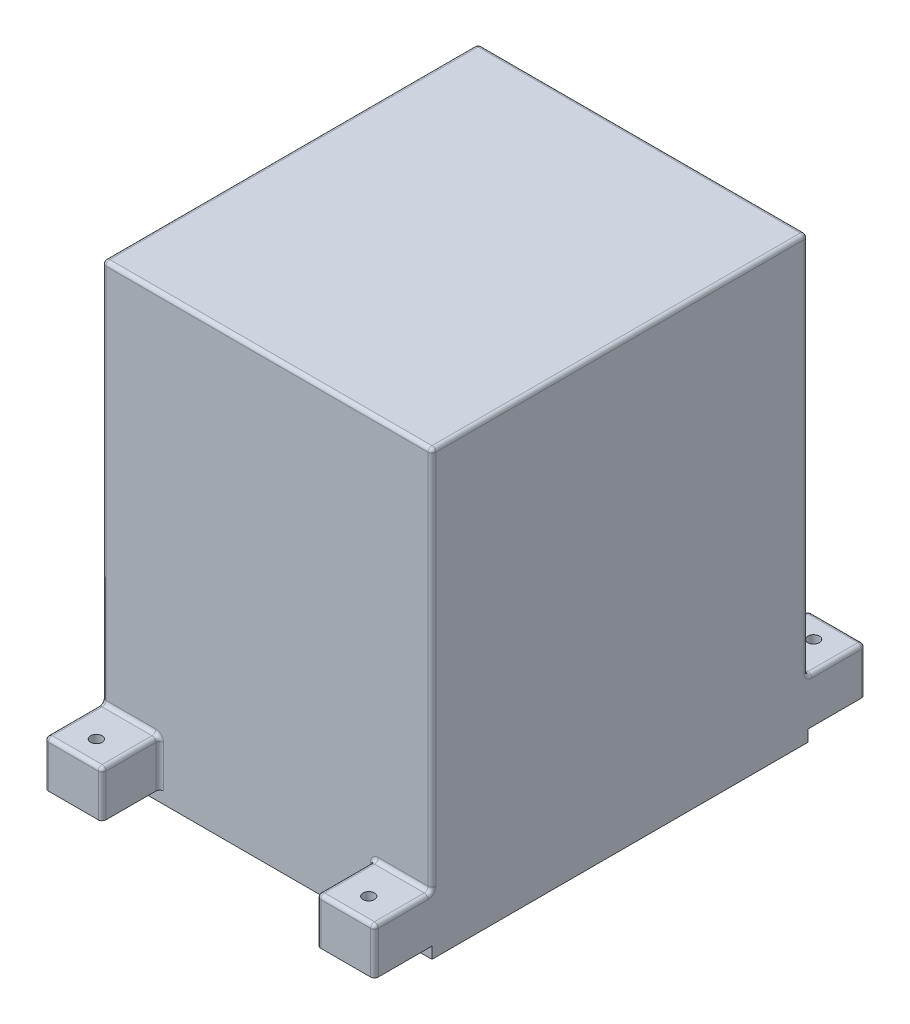
from build123d import *

# Parameters (mm, degrees)
ESBO_O1_W                = 86
ESBO_O1_H                = 98
ESBO_O1_W_2              = 80
ESBO_O1_H_2              = 92
RESSALTO_EXTRUS_O1_DEPTH = 110
ESBO_O2_W                = 86
ESBO_O2_H                = 98
RESSALTO_EXTRUS_O2_DEPTH = 5
ESBO_O3_W                = 7
ESBO_O3_H                = 10
RESSALTO_EXTRUS_O3_DEPTH = 40
ESBO_O4_R                = 3.499646081
CORTE_EXTRUS_O1_DEPTH    = 40
FILETE1_R                = 1
FILETE2_R                = 2
FILETE3_R                = 2
ESBO_O5_W                = 15
ESBO_O5_H                = 15
RESSALTO_EXTRUS_O4_DEPTH = 15
ESBO_O7_W                = 15
ESBO_O7_H                = 3
CORTE_EXTRUS_O2_DEPTH    = 15
ESBO_O8_W                = 15
ESBO_O8_H                = 3
CORTE_EXTRUS_O3_DEPTH    = 15
FILETE4_R                = 1
FILETE5_R                = 1
FILETE6_R                = 1
FILETE7_R                = 1
ESBO_O9_R                = 1.5
CORTE_EXTRUS_O4_DEPTH    = 15
FILETE8_R                = 0.5


with BuildPart() as part:
    # Esboço1 → Ressalto-extrusão1 (new body)
    with BuildSketch(Plane(origin=(0, 0, 0), x_dir=(1, 0, 0), z_dir=(0, 1, 0))):
        with Locations((-397, 490)):
            Rectangle(ESBO_O1_W, ESBO_O1_H)
        with Locations((-397, 490)):
            Rectangle(ESBO_O1_W_2, ESBO_O1_H_2, mode=Mode.SUBTRACT)
    extrude(amount=RESSALTO_EXTRUS_O1_DEPTH)

    # Esboço2 → Ressalto-extrusão2 (add)
    with BuildSketch(Plane(origin=(0, 110, 0), x_dir=(1, 0, 0), z_dir=(0, 1, 0))):
        with Locations((-397, 490)):
            Rectangle(ESBO_O2_W, ESBO_O2_H)
    extrude(amount=RESSALTO_EXTRUS_O2_DEPTH)

    # Esboço3 → Ressalto-extrusão3 (add)
    with BuildSketch(Plane.XZ.offset(-110)):
        with Locations((-433.5, -449)):
            Rectangle(ESBO_O3_W, ESBO_O3_H)
        with Locations((-360.5, -449)):
            Rectangle(ESBO_O3_W, ESBO_O3_H)
        with Locations((-360.5, -531)):
            Rectangle(ESBO_O3_W, ESBO_O3_H)
        with Locations((-433.5, -531)):
            Rectangle(ESBO_O3_W, ESBO_O3_H)
    extrude(amount=RESSALTO_EXTRUS_O3_DEPTH)

    # Esboço4 → Corte-extrusão1 (cut)
    with BuildSketch(Plane.ZY.offset(440)):
        with Locations((-450.5, 55.5)):
            Circle(ESBO_O4_R)
    extrude(amount=-CORTE_EXTRUS_O1_DEPTH, mode=Mode.SUBTRACT)

    # Filete1
    filete1_edges = [part.edges().sort_by_distance(p)[0] for p in [
        (-437, 55.5, -453.999646081),
    ]]
    fillet(filete1_edges, radius=FILETE1_R)

    # Filete2
    filete2_edges = [part.edges().sort_by_distance(p)[0] for p in [
        (-397, 110, -444),
        (-433.5, 110, -454),
        (-437, 90, -454),
        (-430, 110, -449),
        (-430, 90, -454),
        (-430, 90, -444),
        (-437, 110, -490),
    ]]
    fillet(filete2_edges, radius=FILETE2_R)

    # Filete3
    filete3_edges = [part.edges().sort_by_distance(p)[0] for p in [
        (-364, 110, -450),
        (-436.414213562, 109.414213562, -526),
        (-364, 109.414213562, -444.585786438),
        (-357, 110, -490),
        (-357, 90, -454),
        (-364, 89, -444),
        (-360.5, 110, -454),
        (-364, 90, -454),
        (-397, 110, -536),
        (-360.5, 110, -526),
        (-357, 90, -526),
        (-364, 110, -531),
        (-364, 90, -526),
        (-364, 90, -536),
        (-437, 89, -526),
        (-430, 110, -531),
        (-430, 90, -536),
        (-432.5, 110, -526),
        (-430, 90, -526),
    ]]
    fillet(filete3_edges, radius=FILETE3_R)

    # Esboço5 → Ressalto-extrusão4 (add)
    with BuildSketch(Plane.XZ):
        with Locations((-432.5, -433.5)):
            Rectangle(ESBO_O5_W, ESBO_O5_H)
        with Locations((-361.5, -433.5)):
            Rectangle(ESBO_O5_W, ESBO_O5_H)
        with Locations((-432.5, -546.5)):
            Rectangle(ESBO_O5_W, ESBO_O5_H)
        with Locations((-361.5, -546.5)):
            Rectangle(ESBO_O5_W, ESBO_O5_H)
    extrude(amount=-RESSALTO_EXTRUS_O4_DEPTH)

    # Esboço7 → Corte-extrusão2 (cut)
    with BuildSketch(Plane(origin=(0, 0, -554), x_dir=(-1, 0, 0), z_dir=(0, 0, -1))):
        with Locations((432.5, 1.5)):
            Rectangle(ESBO_O7_W, ESBO_O7_H)
        with Locations((361.5, 1.5)):
            Rectangle(ESBO_O7_W, ESBO_O7_H)
    extrude(amount=-CORTE_EXTRUS_O2_DEPTH, mode=Mode.SUBTRACT)

    # Esboço8 → Corte-extrusão3 (cut)
    with BuildSketch(Plane.XY.offset(-426)):
        with Locations((-432.5, 1.5)):
            Rectangle(ESBO_O8_W, ESBO_O8_H)
        with Locations((-361.5, 1.5)):
            Rectangle(ESBO_O8_W, ESBO_O8_H)
    extrude(amount=-CORTE_EXTRUS_O3_DEPTH, mode=Mode.SUBTRACT)

    # Filete4
    filete4_edges = [part.edges().sort_by_distance(p)[0] for p in [
        (-440, 15, -433.5),
        (-432.5, 15, -426),
        (-425, 15, -433.5),
        (-432.5, 15, -441),
        (-425, 9, -441),
        (-440, 65, -441),
    ]]
    fillet(filete4_edges, radius=FILETE4_R)

    # Filete5
    # the kernel refuses this fillet: 1 mm, written as the material it takes off along each edge
    with BuildSketch(Plane(origin=(-426, 14, -427), x_dir=(0, 0, 1), z_dir=(1, 0, 0))) as filete5_piece_1_section:
        Polygon((0, 0), (FILETE5_R, 0), (FILETE5_R, -FILETE5_R), (0, -FILETE5_R), align=None)
    filete5_piece_1 = extrude(amount=FILETE5_R, mode=Mode.PRIVATE)
    filete5_piece_1 = filete5_piece_1 - Plane(origin=(-426, 14, -427), x_dir=(0, -0.7071067811865475, -0.7071067811865475), z_dir=(1, 0, 0)) * Sphere(FILETE5_R, mode=Mode.PRIVATE)
    add(filete5_piece_1, mode=Mode.SUBTRACT)
    with BuildSketch(Plane(origin=(-439, 14, -427), x_dir=(0, 0, 1), z_dir=(-1, 0, 0))) as filete5_piece_2_section:
        Polygon((0, 0), (FILETE5_R, 0), (FILETE5_R, FILETE5_R), (0, FILETE5_R), align=None)
    filete5_piece_2 = extrude(amount=FILETE5_R, mode=Mode.PRIVATE)
    filete5_piece_2 = filete5_piece_2 - Plane(origin=(-439, 14, -427), x_dir=(0, -0.7071067811865475, -0.7071067811865475), z_dir=(-1, 0, 0)) * Sphere(FILETE5_R, mode=Mode.PRIVATE)
    add(filete5_piece_2, mode=Mode.SUBTRACT)
    with BuildSketch(Plane(origin=(-440, 0.5, -426), x_dir=(0, 0, -1), z_dir=(0, 1, 0))) as filete5_piece_3:
        with BuildLine():
            CenterArc((FILETE5_R, -FILETE5_R), FILETE5_R, 90, 90)
            Line((0, -FILETE5_R), (0, 0))
            Line((0, 0), (FILETE5_R, 0))
        make_face()
    extrude(amount=13.5, mode=Mode.SUBTRACT)
    with BuildSketch(Plane(origin=(-425, 0.5, -426), x_dir=(0, 0, -1), z_dir=(0, 1, 0))) as filete5_piece_4:
        with BuildLine():
            CenterArc((FILETE5_R, FILETE5_R), FILETE5_R, 180, 90)
            Line((0, FILETE5_R), (0, 0))
            Line((0, 0), (FILETE5_R, 0))
        make_face()
    extrude(amount=13.5, mode=Mode.SUBTRACT)

    # Filete6
    filete6_edges = [part.edges().sort_by_distance(p)[0] for p in [
        (-354, 15, -433.5),
        (-361.5, 15, -441),
        (-440, 115, -490.5),
        (-439.707106781, 115, -441.292893219),
        (-396.5, 115, -441),
        (-354, 65, -441),
        (-361.5, 15, -426),
        (-369, 15, -433.5),
        (-354, 9, -426),
        (-369, 9, -426),
        (-369, 9, -441),
    ]]
    fillet(filete6_edges, radius=FILETE6_R)

    # Filete7
    # the kernel refuses this fillet: 1 mm, written as the material it takes off along each edge
    with BuildSketch(Plane(origin=(-355, 114, -442), x_dir=(1, 0, 0), z_dir=(0, 1, 0))) as filete7_piece_1_section:
        Polygon((0, 0), (FILETE7_R, 0), (FILETE7_R, -FILETE7_R), (0, -FILETE7_R), align=None)
    filete7_piece_1 = extrude(amount=FILETE7_R, mode=Mode.PRIVATE)
    filete7_piece_1 = filete7_piece_1 - Plane(origin=(-355, 114, -442), x_dir=(-0.7071067811865475, 0, -0.7071067811865475), z_dir=(0, 1, 0)) * Sphere(FILETE7_R, mode=Mode.PRIVATE)
    add(filete7_piece_1, mode=Mode.SUBTRACT)
    with BuildSketch(Plane(origin=(-426, 14, -553), x_dir=(0, 0, -1), z_dir=(1, 0, 0))) as filete7_piece_2_section:
        Polygon((0, 0), (FILETE7_R, 0), (FILETE7_R, FILETE7_R), (0, FILETE7_R), align=None)
    filete7_piece_2 = extrude(amount=FILETE7_R, mode=Mode.PRIVATE)
    filete7_piece_2 = filete7_piece_2 - Plane(origin=(-426, 14, -553), x_dir=(0, -0.7071067811865475, 0.7071067811865475), z_dir=(1, 0, 0)) * Sphere(FILETE7_R, mode=Mode.PRIVATE)
    add(filete7_piece_2, mode=Mode.SUBTRACT)
    with BuildSketch(Plane(origin=(-368, 14, -553), x_dir=(-1, 0, 0), z_dir=(0, 1, 0))) as filete7_piece_3_section:
        Polygon((0, 0), (FILETE7_R, 0), (FILETE7_R, -FILETE7_R), (0, -FILETE7_R), align=None)
    filete7_piece_3 = extrude(amount=FILETE7_R, mode=Mode.PRIVATE)
    filete7_piece_3 = filete7_piece_3 - Plane(origin=(-368, 14, -553), x_dir=(0.7071067811865475, 0, 0.7071067811865475), z_dir=(0, 1, 0)) * Sphere(FILETE7_R, mode=Mode.PRIVATE)
    add(filete7_piece_3, mode=Mode.SUBTRACT)
    with BuildSketch(Plane(origin=(-440, 0.5, -554), x_dir=(0, 0, 1), z_dir=(0, 1, 0))) as filete7_piece_4:
        with BuildLine():
            CenterArc((FILETE7_R, FILETE7_R), FILETE7_R, 180, 90)
            Line((0, FILETE7_R), (0, 0))
            Line((0, 0), (FILETE7_R, 0))
        make_face()
    extrude(amount=17, mode=Mode.SUBTRACT)
    with BuildSketch(Plane(origin=(-425, 15, -539), x_dir=(0, -1, 0), z_dir=(0, 0, -1)), Plane(origin=(-369, 15, -539), x_dir=(1, 0, 0), z_dir=(0, 0, -1))) as filete7_piece_5:
        with BuildLine():
            CenterArc((FILETE7_R, FILETE7_R), FILETE7_R, 180, 90)
            Line((0, FILETE7_R), (0, 0))
            Line((0, 0), (FILETE7_R, 0))
        make_face()
    extrude(amount=14, mode=Mode.SUBTRACT)
    with BuildSketch(Plane(origin=(-426, 15, -554), x_dir=(0, -1, 0), z_dir=(-1, 0, 0)), Plane(origin=(-368, 15, -554), x_dir=(0, 0, 1), z_dir=(1, 0, 0))) as filete7_piece_6:
        with BuildLine():
            CenterArc((FILETE7_R, FILETE7_R), FILETE7_R, 180, 90)
            Line((0, FILETE7_R), (0, 0))
            Line((0, 0), (FILETE7_R, 0))
        make_face()
    extrude(amount=16.5, mode=Mode.SUBTRACT)
    with BuildSketch(Plane(origin=(-425, 0.5, -554), x_dir=(0, 0, 1), z_dir=(0, 1, 0))) as filete7_piece_7:
        with BuildLine():
            CenterArc((FILETE7_R, -FILETE7_R), FILETE7_R, 90, 90)
            Line((0, -FILETE7_R), (0, 0))
            Line((0, 0), (FILETE7_R, 0))
        make_face()
    extrude(amount=13.5, mode=Mode.SUBTRACT)
    with BuildSketch(Plane(origin=(-354, 0.5, -554), x_dir=(0, 0, 1), z_dir=(0, 1, 0))) as filete7_piece_8:
        with BuildLine():
            CenterArc((FILETE7_R, -FILETE7_R), FILETE7_R, 90, 90)
            Line((0, -FILETE7_R), (0, 0))
            Line((0, 0), (FILETE7_R, 0))
        make_face()
    extrude(amount=17, mode=Mode.SUBTRACT)
    with BuildSketch(Plane(origin=(-369, 0.5, -554), x_dir=(0, 0, 1), z_dir=(0, 1, 0))) as filete7_piece_9:
        with BuildLine():
            CenterArc((FILETE7_R, FILETE7_R), FILETE7_R, 180, 90)
            Line((0, FILETE7_R), (0, 0))
            Line((0, 0), (FILETE7_R, 0))
        make_face()
    extrude(amount=13.5, mode=Mode.SUBTRACT)
    with BuildSketch(Plane(origin=(-354, 115, -442), x_dir=(-1, 0, 0), z_dir=(0, 0, -1))) as filete7_piece_10:
        with BuildLine():
            CenterArc((FILETE7_R, -FILETE7_R), FILETE7_R, 90, 90)
            Line((0, -FILETE7_R), (0, 0))
            Line((0, 0), (FILETE7_R, 0))
        make_face()
    extrude(amount=99.5, mode=Mode.SUBTRACT)
    # the kernel refuses this fillet: 1 mm, written as the material it adds along each edge
    with BuildSketch(Plane(origin=(-440, 15, -539), x_dir=(0, 1, 0), z_dir=(1, 0, 0))) as filete7_2_piece_1:
        with BuildLine():
            CenterArc((FILETE7_R, -FILETE7_R), FILETE7_R, 90, 90)
            Line((0, -FILETE7_R), (0, 0))
            Line((0, 0), (FILETE7_R, 0))
        make_face()
    extrude(amount=14)
    with BuildSketch(Plane(origin=(-425, 3, -539), x_dir=(1, 0, 0), z_dir=(0, 1, 0))) as filete7_2_piece_2:
        with BuildLine():
            CenterArc((FILETE7_R, FILETE7_R), FILETE7_R, 180, 90)
            Line((0, FILETE7_R), (0, 0))
            Line((0, 0), (FILETE7_R, 0))
        make_face()
    extrude(amount=11)
    with BuildSketch(Plane(origin=(-354, 15, -539), x_dir=(0, 1, 0), z_dir=(-1, 0, 0))) as filete7_2_piece_3:
        with BuildLine():
            CenterArc((FILETE7_R, FILETE7_R), FILETE7_R, 180, 90)
            Line((0, FILETE7_R), (0, 0))
            Line((0, 0), (FILETE7_R, 0))
        make_face()
    extrude(amount=14)
    with BuildSketch(Plane(origin=(-369, 3, -539), x_dir=(-1, 0, 0), z_dir=(0, 1, 0))) as filete7_2_piece_4:
        with BuildLine():
            CenterArc((FILETE7_R, -FILETE7_R), FILETE7_R, 90, 90)
            Line((0, -FILETE7_R), (0, 0))
            Line((0, 0), (FILETE7_R, 0))
        make_face()
    extrude(amount=11)
    with BuildSketch(Plane(origin=(-368, 14, -539), x_dir=(0, 1, 0), z_dir=(1, 0, 0))) as filete7_2_piece_5:
        with BuildLine():
            CenterArc((1 + FILETE7_R, -FILETE7_R), FILETE7_R, 90, 90)
            Line((1, -FILETE7_R), (1, 0))
            Line((1, 0), (1 + FILETE7_R, 0))
        make_face()
    revolve(axis=Axis((-368, 14, -539), (0, 0, 1)), revolution_arc=90)
    with BuildSketch(Plane(origin=(-426, 14, -539), x_dir=(1, 0, 0), z_dir=(0, -1, 0))) as filete7_2_piece_6:
        with BuildLine():
            CenterArc((1 + FILETE7_R, -FILETE7_R), FILETE7_R, 90, 90)
            Line((1, -FILETE7_R), (1, 0))
            Line((1, 0), (1 + FILETE7_R, 0))
        make_face()
    revolve(axis=Axis((-426, 14, -539), (0, 0, 1)), revolution_arc=90)
    # the kernel refuses this fillet: 1 mm, written as the material it takes off along each edge
    with BuildSketch(Plane(origin=(-355, 14, -553), x_dir=(0, 1, 0), z_dir=(1, 0, 0))) as filete7_3_piece_1_section:
        Polygon((0, 0), (FILETE7_R, 0), (FILETE7_R, -FILETE7_R), (0, -FILETE7_R), align=None)
    filete7_3_piece_1 = extrude(amount=FILETE7_R, mode=Mode.PRIVATE)
    filete7_3_piece_1 = filete7_3_piece_1 - Plane(origin=(-355, 14, -553), x_dir=(0, -0.7071067811865475, 0.7071067811865475), z_dir=(1, 0, 0)) * Sphere(FILETE7_R, mode=Mode.PRIVATE)
    add(filete7_3_piece_1, mode=Mode.SUBTRACT)
    with BuildSketch(Plane(origin=(-439, 14, -553), x_dir=(0, 1, 0), z_dir=(-1, 0, 0))) as filete7_3_piece_2_section:
        Polygon((0, 0), (FILETE7_R, 0), (FILETE7_R, FILETE7_R), (0, FILETE7_R), align=None)
    filete7_3_piece_2 = extrude(amount=FILETE7_R, mode=Mode.PRIVATE)
    filete7_3_piece_2 = filete7_3_piece_2 - Plane(origin=(-439, 14, -553), x_dir=(0, -0.7071067811865475, 0.7071067811865475), z_dir=(-1, 0, 0)) * Sphere(FILETE7_R, mode=Mode.PRIVATE)
    add(filete7_3_piece_2, mode=Mode.SUBTRACT)
    with BuildSketch(Plane(origin=(-440, 15, -553), x_dir=(0, -1, 0), z_dir=(0, 0, 1))) as filete7_3_piece_3:
        with BuildLine():
            CenterArc((FILETE7_R, FILETE7_R), FILETE7_R, 180, 90)
            Line((0, FILETE7_R), (0, 0))
            Line((0, 0), (FILETE7_R, 0))
        make_face()
    extrude(amount=13, mode=Mode.SUBTRACT)
    with BuildSketch(Plane(origin=(-354, 15, -553), x_dir=(0, -1, 0), z_dir=(0, 0, 1))) as filete7_3_piece_4:
        with BuildLine():
            CenterArc((FILETE7_R, -FILETE7_R), FILETE7_R, 90, 90)
            Line((0, -FILETE7_R), (0, 0))
            Line((0, 0), (FILETE7_R, 0))
        make_face()
    extrude(amount=13, mode=Mode.SUBTRACT)
    with BuildSketch(Plane(origin=(-355, 115, -539), x_dir=(0, 0, 1), z_dir=(-1, 0, 0))) as filete7_3_piece_5:
        with BuildLine():
            CenterArc((FILETE7_R, -FILETE7_R), FILETE7_R, 90, 90)
            Line((0, -FILETE7_R), (0, 0))
            Line((0, 0), (FILETE7_R, 0))
        make_face()
    extrude(amount=84, mode=Mode.SUBTRACT)
    with BuildSketch(Plane(origin=(-440, 114, -539), x_dir=(0, 0, 1), z_dir=(0, -1, 0)), Plane(origin=(-354, 16, -539), x_dir=(0, 0, 1), z_dir=(0, 1, 0))) as filete7_3_piece_6:
        with BuildLine():
            CenterArc((FILETE7_R, -FILETE7_R), FILETE7_R, 90, 90)
            Line((0, -FILETE7_R), (0, 0))
            Line((0, 0), (FILETE7_R, 0))
        make_face()
    extrude(amount=98, mode=Mode.SUBTRACT)
    with BuildSketch(Plane(origin=(-439, 114, -539), x_dir=(-1, 0, 0), z_dir=(0, -1, 0))) as filete7_3_piece_7:
        with BuildLine():
            CenterArc((1 - FILETE7_R, -FILETE7_R), FILETE7_R, 0, 90)
            Line((1, -FILETE7_R), (1, 0))
            Line((1, 0), (1 - FILETE7_R, 0))
        make_face()
    revolve(axis=Axis((-439, 114, -539), (0, 0, -1)), revolution_arc=90, mode=Mode.SUBTRACT)
    with BuildSketch(Plane(origin=(-354, 16, -540), x_dir=(0, 0, 1), z_dir=(0, 1, 0))) as filete7_3_piece_8:
        with BuildLine():
            CenterArc((1 + FILETE7_R, -FILETE7_R), FILETE7_R, 90, 90)
            Line((1, -FILETE7_R), (1, 0))
            Line((1, 0), (1 + FILETE7_R, 0))
        make_face()
    revolve(axis=Axis((-354, 16, -540), (1, 0, 0)), revolution_arc=90, mode=Mode.SUBTRACT)
    with BuildSketch(Plane(origin=(-355, 114, -539), x_dir=(1, 0, 0), z_dir=(0, -1, 0))) as filete7_3_piece_9:
        with BuildLine():
            CenterArc((1 - FILETE7_R, FILETE7_R), FILETE7_R, 270, 90)
            Line((1 - FILETE7_R, 0), (1, 0))
            Line((1, 0), (1, FILETE7_R))
        make_face()
    revolve(axis=Axis((-355, 114, -539), (0, 0, 1)), revolution_arc=90, mode=Mode.SUBTRACT)
    with BuildSketch(Plane(origin=(-440, 16, -540), x_dir=(0, 0, 1), z_dir=(0, 1, 0))) as filete7_3_piece_10:
        with BuildLine():
            CenterArc((1 + FILETE7_R, FILETE7_R), FILETE7_R, 180, 90)
            Line((1, FILETE7_R), (1, 0))
            Line((1, 0), (1 + FILETE7_R, 0))
        make_face()
    revolve(axis=Axis((-440, 16, -540), (1, 0, 0)), revolution_arc=90, mode=Mode.SUBTRACT)

    # Esboço9 → Corte-extrusão4 (cut)
    with BuildSketch(Plane.XZ.offset(-3)):
        with Locations((-432.5, -432)):
            Circle(ESBO_O9_R)
        with Locations((-361.5, -432)):
            Circle(ESBO_O9_R)
        with Locations((-361.5, -548)):
            Circle(ESBO_O9_R)
        with Locations((-432.5, -548)):
            Circle(ESBO_O9_R)
    extrude(amount=-CORTE_EXTRUS_O4_DEPTH, mode=Mode.SUBTRACT)

    # Filete8
    filete8_edges = [part.edges().sort_by_distance(p)[0] for p in [
        (-434, 3, -432),
        (-363, 3, -432),
        (-363, 3, -548),
        (-434, 3, -548),
    ]]
    fillet(filete8_edges, radius=FILETE8_R)


solid = part.part
